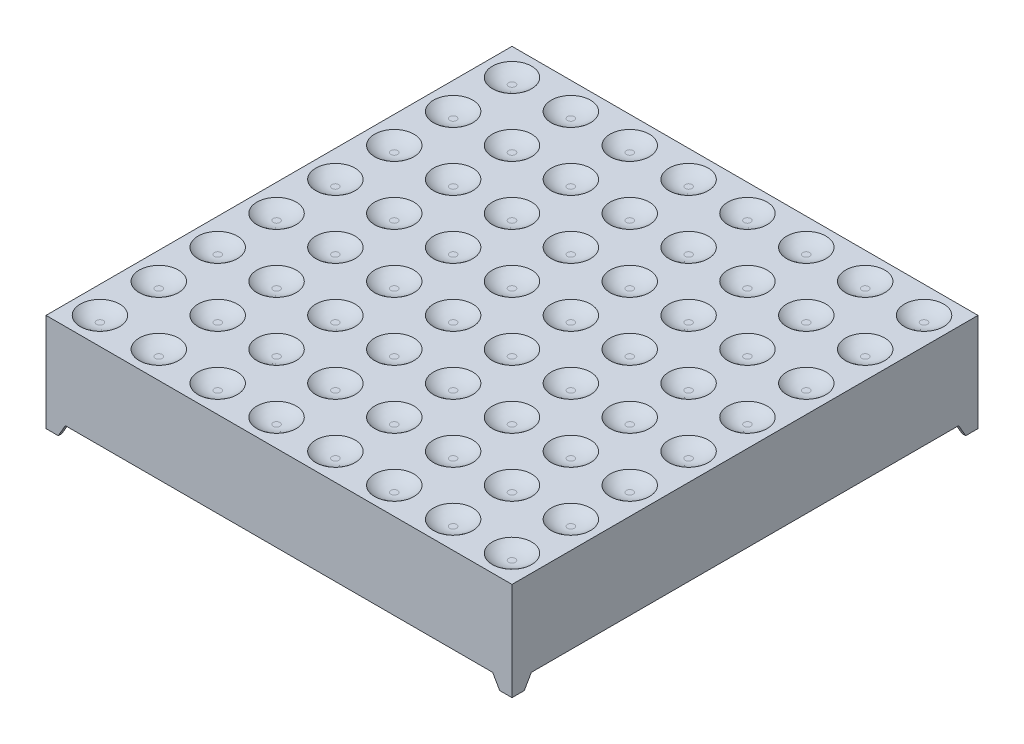
from build123d import *

# Parameters (mm, degrees)
SKETCH1_W           = 38
SKETCH1_H           = 38
BOSS_EXTRUDE1_DEPTH = 4
SKETCH2_W           = 37.4
SKETCH2_H           = 37.4
CUT_EXTRUDE1_DEPTH  = 1.5
CUT_EXTRUDE2_DEPTH  = 43.673176587
CUT_EXTRUDE3_DEPTH  = 43.673176587
SKETCH5_R           = 1.6
CUT_EXTRUDE4_DEPTH  = 0.5
FILLET1_R           = 2
SKETCH6_R           = 0.255
BOSS_EXTRUDE2_DEPTH = 6


with BuildPart() as part:
    # Sketch1 → Boss-Extrude1 (new, symmetric)
    with BuildSketch(Plane(origin=(0, 0, 0), x_dir=(1, 0, 0), z_dir=(0, 1, 0))):
        Rectangle(SKETCH1_W, SKETCH1_H)
    extrude(amount=BOSS_EXTRUDE1_DEPTH, both=True)

    # Sketch2 → Cut-Extrude1 (cut)
    with BuildSketch(Plane.XZ.offset(4)):
        Rectangle(SKETCH2_W, SKETCH2_H)
    extrude(amount=-CUT_EXTRUDE1_DEPTH, mode=Mode.SUBTRACT)

    # Sketch3 → Cut-Extrude2 (cut, through all)
    with BuildSketch(Plane.XY.offset(19)):
        Polygon((-18, -4), (-17.422649731, -3), (17.422649731, -3), (18, -4), align=None)
    extrude(amount=-CUT_EXTRUDE2_DEPTH, mode=Mode.SUBTRACT)

    # Sketch4 → Cut-Extrude3 (cut, through all)
    with BuildSketch(Plane.ZY.offset(19)):
        Polygon((-18, -4), (-17.422649731, -3), (17.422649731, -3), (18, -4), align=None)
    extrude(amount=-CUT_EXTRUDE3_DEPTH, mode=Mode.SUBTRACT)

    # Sketch5 → Cut-Extrude4 (cut)
    with BuildSketch(Plane(origin=(0, 4, 0), x_dir=(1, 0, 0), z_dir=(0, 1, 0))):
        with Locations(Location((-16.8, 16.8, 0), (0, 0, 270))):
            Circle(SKETCH5_R)
        with Locations(Location((-12, 16.8, 0), (0, 0, 270))):
            Circle(SKETCH5_R)
        with Locations(Location((-7.2, 16.8, 0), (0, 0, 270))):
            Circle(SKETCH5_R)
        with Locations(Location((-2.4, 16.8, 0), (0, 0, 270))):
            Circle(SKETCH5_R)
        with Locations(Location((2.4, 16.8, 0), (0, 0, 270))):
            Circle(SKETCH5_R)
        with Locations(Location((7.2, 16.8, 0), (0, 0, 270))):
            Circle(SKETCH5_R)
        with Locations(Location((12, 16.8, 0), (0, 0, 270))):
            Circle(SKETCH5_R)
        with Locations(Location((16.8, 16.8, 0), (0, 0, 270))):
            Circle(SKETCH5_R)
        with Locations(Location((-16.8, 12, 0), (0, 0, 270))):
            Circle(SKETCH5_R)
        with Locations(Location((-12, 12, 0), (0, 0, 270))):
            Circle(SKETCH5_R)
        with Locations(Location((-7.2, 12, 0), (0, 0, 270))):
            Circle(SKETCH5_R)
        with Locations(Location((-2.4, 12, 0), (0, 0, 270))):
            Circle(SKETCH5_R)
        with Locations(Location((2.4, 12, 0), (0, 0, 270))):
            Circle(SKETCH5_R)
        with Locations(Location((7.2, 12, 0), (0, 0, 270))):
            Circle(SKETCH5_R)
        with Locations(Location((12, 12, 0), (0, 0, 270))):
            Circle(SKETCH5_R)
        with Locations(Location((16.8, 12, 0), (0, 0, 270))):
            Circle(SKETCH5_R)
        with Locations(Location((-16.8, 7.2, 0), (0, 0, 270))):
            Circle(SKETCH5_R)
        with Locations(Location((-12, 7.2, 0), (0, 0, 270))):
            Circle(SKETCH5_R)
        with Locations(Location((-7.2, 7.2, 0), (0, 0, 270))):
            Circle(SKETCH5_R)
        with Locations(Location((-2.4, 7.2, 0), (0, 0, 270))):
            Circle(SKETCH5_R)
        with Locations(Location((2.4, 7.2, 0), (0, 0, 270))):
            Circle(SKETCH5_R)
        with Locations(Location((7.2, 7.2, 0), (0, 0, 270))):
            Circle(SKETCH5_R)
        with Locations(Location((12, 7.2, 0), (0, 0, 270))):
            Circle(SKETCH5_R)
        with Locations(Location((16.8, 7.2, 0), (0, 0, 270))):
            Circle(SKETCH5_R)
        with Locations(Location((-16.8, 2.4, 0), (0, 0, 270))):
            Circle(SKETCH5_R)
        with Locations(Location((-12, 2.4, 0), (0, 0, 270))):
            Circle(SKETCH5_R)
        with Locations(Location((-7.2, 2.4, 0), (0, 0, 270))):
            Circle(SKETCH5_R)
        with Locations(Location((-2.4, 2.4, 0), (0, 0, 270))):
            Circle(SKETCH5_R)
        with Locations(Location((2.4, 2.4, 0), (0, 0, 270))):
            Circle(SKETCH5_R)
        with Locations(Location((7.2, 2.4, 0), (0, 0, 270))):
            Circle(SKETCH5_R)
        with Locations(Location((12, 2.4, 0), (0, 0, 270))):
            Circle(SKETCH5_R)
        with Locations(Location((16.8, 2.4, 0), (0, 0, 270))):
            Circle(SKETCH5_R)
        with Locations(Location((-16.8, -2.4, 0), (0, 0, 270))):
            Circle(SKETCH5_R)
        with Locations(Location((-12, -2.4, 0), (0, 0, 270))):
            Circle(SKETCH5_R)
        with Locations(Location((-7.2, -2.4, 0), (0, 0, 270))):
            Circle(SKETCH5_R)
        with Locations(Location((-2.4, -2.4, 0), (0, 0, 270))):
            Circle(SKETCH5_R)
        with Locations(Location((2.4, -2.4, 0), (0, 0, 270))):
            Circle(SKETCH5_R)
        with Locations(Location((7.2, -2.4, 0), (0, 0, 270))):
            Circle(SKETCH5_R)
        with Locations(Location((12, -2.4, 0), (0, 0, 270))):
            Circle(SKETCH5_R)
        with Locations(Location((16.8, -2.4, 0), (0, 0, 270))):
            Circle(SKETCH5_R)
        with Locations(Location((-16.8, -7.2, 0), (0, 0, 270))):
            Circle(SKETCH5_R)
        with Locations(Location((-12, -7.2, 0), (0, 0, 270))):
            Circle(SKETCH5_R)
        with Locations(Location((-7.2, -7.2, 0), (0, 0, 270))):
            Circle(SKETCH5_R)
        with Locations(Location((-2.4, -7.2, 0), (0, 0, 270))):
            Circle(SKETCH5_R)
        with Locations(Location((2.4, -7.2, 0), (0, 0, 270))):
            Circle(SKETCH5_R)
        with Locations(Location((7.2, -7.2, 0), (0, 0, 270))):
            Circle(SKETCH5_R)
        with Locations(Location((12, -7.2, 0), (0, 0, 270))):
            Circle(SKETCH5_R)
        with Locations(Location((16.8, -7.2, 0), (0, 0, 270))):
            Circle(SKETCH5_R)
        with Locations(Location((-16.8, -12, 0), (0, 0, 270))):
            Circle(SKETCH5_R)
        with Locations(Location((-12, -12, 0), (0, 0, 270))):
            Circle(SKETCH5_R)
        with Locations(Location((-7.2, -12, 0), (0, 0, 270))):
            Circle(SKETCH5_R)
        with Locations(Location((-2.4, -12, 0), (0, 0, 270))):
            Circle(SKETCH5_R)
        with Locations(Location((2.4, -12, 0), (0, 0, 270))):
            Circle(SKETCH5_R)
        with Locations(Location((7.2, -12, 0), (0, 0, 270))):
            Circle(SKETCH5_R)
        with Locations(Location((12, -12, 0), (0, 0, 270))):
            Circle(SKETCH5_R)
        with Locations(Location((16.8, -12, 0), (0, 0, 270))):
            Circle(SKETCH5_R)
        with Locations(Location((-16.8, -16.8, 0), (0, 0, 270))):
            Circle(SKETCH5_R)
        with Locations(Location((-12, -16.8, 0), (0, 0, 270))):
            Circle(SKETCH5_R)
        with Locations(Location((-7.2, -16.8, 0), (0, 0, 270))):
            Circle(SKETCH5_R)
        with Locations(Location((-2.4, -16.8, 0), (0, 0, 270))):
            Circle(SKETCH5_R)
        with Locations(Location((2.4, -16.8, 0), (0, 0, 270))):
            Circle(SKETCH5_R)
        with Locations(Location((7.2, -16.8, 0), (0, 0, 270))):
            Circle(SKETCH5_R)
        with Locations(Location((12, -16.8, 0), (0, 0, 270))):
            Circle(SKETCH5_R)
        with Locations(Location((16.8, -16.8, 0), (0, 0, 270))):
            Circle(SKETCH5_R)
    extrude(amount=-CUT_EXTRUDE4_DEPTH, mode=Mode.SUBTRACT)

    # Fillet1
    # the kernel refuses this fillet: 2 mm, written as the material it adds along each edge
    with BuildSketch(Plane(origin=(7.2, 3.5, -16.8), x_dir=(0, 0, 1), z_dir=(-1, 0, 0))) as fillet1_piece_1:
        with BuildLine():
            CenterArc((0.277124344, 2), FILLET1_R, 270, 41.409622109)
            Line((0.277124344, 0), (0.277124344, -0.04))
            Line((0.277124344, -0.04), (1.6, -0.04))
            Line((1.6, -0.04), (1.64, 0))
            ThreePointArc((1.64, 0), (1.64, 0.25), (1.626457513, 0.47))
            Line((1.626457513, 0.47), (1.6, 0.5))
        make_face()
    revolve(axis=Axis((7.2, 3.5, -16.8), (0, 1, 0)))
    with BuildSketch(Plane(origin=(12, 3.5, -16.8), x_dir=(0, 0, 1), z_dir=(-1, 0, 0))) as fillet1_piece_2:
        with BuildLine():
            CenterArc((0.277124344, 2), FILLET1_R, 270, 41.409622109)
            Line((0.277124344, 0), (0.277124344, -0.04))
            Line((0.277124344, -0.04), (1.6, -0.04))
            Line((1.6, -0.04), (1.64, 0))
            ThreePointArc((1.64, 0), (1.64, 0.25), (1.626457513, 0.47))
            Line((1.626457513, 0.47), (1.6, 0.5))
        make_face()
    revolve(axis=Axis((12, 3.5, -16.8), (0, 1, 0)))
    with BuildSketch(Plane(origin=(16.8, 3.5, -16.8), x_dir=(0, 0, 1), z_dir=(-1, 0, 0))) as fillet1_piece_3:
        with BuildLine():
            CenterArc((0.277124344, 2), FILLET1_R, 270, 41.409622109)
            Line((0.277124344, 0), (0.277124344, -0.04))
            Line((0.277124344, -0.04), (1.6, -0.04))
            Line((1.6, -0.04), (1.64, 0))
            ThreePointArc((1.64, 0), (1.64, 0.25), (1.626457513, 0.47))
            Line((1.626457513, 0.47), (1.6, 0.5))
        make_face()
    revolve(axis=Axis((16.8, 3.5, -16.8), (0, 1, 0)))
    with BuildSketch(Plane(origin=(-16.8, 3.5, -12), x_dir=(0, 0, 1), z_dir=(-1, 0, 0))) as fillet1_piece_4:
        with BuildLine():
            CenterArc((0.277124344, 2), FILLET1_R, 270, 41.409622109)
            Line((0.277124344, 0), (0.277124344, -0.04))
            Line((0.277124344, -0.04), (1.6, -0.04))
            Line((1.6, -0.04), (1.64, 0))
            ThreePointArc((1.64, 0), (1.64, 0.25), (1.626457513, 0.47))
            Line((1.626457513, 0.47), (1.6, 0.5))
        make_face()
    revolve(axis=Axis((-16.8, 3.5, -12), (0, 1, 0)))
    with BuildSketch(Plane(origin=(-12, 3.5, -12), x_dir=(0, 0, 1), z_dir=(-1, 0, 0))) as fillet1_piece_5:
        with BuildLine():
            CenterArc((0.277124344, 2), FILLET1_R, 270, 41.409622109)
            Line((0.277124344, 0), (0.277124344, -0.04))
            Line((0.277124344, -0.04), (1.6, -0.04))
            Line((1.6, -0.04), (1.64, 0))
            ThreePointArc((1.64, 0), (1.64, 0.25), (1.626457513, 0.47))
            Line((1.626457513, 0.47), (1.6, 0.5))
        make_face()
    revolve(axis=Axis((-12, 3.5, -12), (0, 1, 0)))
    with BuildSketch(Plane(origin=(-7.2, 3.5, -12), x_dir=(0, 0, 1), z_dir=(-1, 0, 0))) as fillet1_piece_6:
        with BuildLine():
            CenterArc((0.277124344, 2), FILLET1_R, 270, 41.409622109)
            Line((0.277124344, 0), (0.277124344, -0.04))
            Line((0.277124344, -0.04), (1.6, -0.04))
            Line((1.6, -0.04), (1.64, 0))
            ThreePointArc((1.64, 0), (1.64, 0.25), (1.626457513, 0.47))
            Line((1.626457513, 0.47), (1.6, 0.5))
        make_face()
    revolve(axis=Axis((-7.2, 3.5, -12), (0, 1, 0)))
    with BuildSketch(Plane(origin=(-2.4, 3.5, -12), x_dir=(0, 0, 1), z_dir=(-1, 0, 0))) as fillet1_piece_7:
        with BuildLine():
            CenterArc((0.277124344, 2), FILLET1_R, 270, 41.409622109)
            Line((0.277124344, 0), (0.277124344, -0.04))
            Line((0.277124344, -0.04), (1.6, -0.04))
            Line((1.6, -0.04), (1.64, 0))
            ThreePointArc((1.64, 0), (1.64, 0.25), (1.626457513, 0.47))
            Line((1.626457513, 0.47), (1.6, 0.5))
        make_face()
    revolve(axis=Axis((-2.4, 3.5, -12), (0, 1, 0)))
    with BuildSketch(Plane(origin=(2.4, 3.5, -12), x_dir=(0, 0, 1), z_dir=(-1, 0, 0))) as fillet1_piece_8:
        with BuildLine():
            CenterArc((0.277124344, 2), FILLET1_R, 270, 41.409622109)
            Line((0.277124344, 0), (0.277124344, -0.04))
            Line((0.277124344, -0.04), (1.6, -0.04))
            Line((1.6, -0.04), (1.64, 0))
            ThreePointArc((1.64, 0), (1.64, 0.25), (1.626457513, 0.47))
            Line((1.626457513, 0.47), (1.6, 0.5))
        make_face()
    revolve(axis=Axis((2.4, 3.5, -12), (0, 1, 0)))
    with BuildSketch(Plane(origin=(7.2, 3.5, -12), x_dir=(0, 0, 1), z_dir=(-1, 0, 0))) as fillet1_piece_9:
        with BuildLine():
            CenterArc((0.277124344, 2), FILLET1_R, 270, 41.409622109)
            Line((0.277124344, 0), (0.277124344, -0.04))
            Line((0.277124344, -0.04), (1.6, -0.04))
            Line((1.6, -0.04), (1.64, 0))
            ThreePointArc((1.64, 0), (1.64, 0.25), (1.626457513, 0.47))
            Line((1.626457513, 0.47), (1.6, 0.5))
        make_face()
    revolve(axis=Axis((7.2, 3.5, -12), (0, 1, 0)))
    with BuildSketch(Plane(origin=(12, 3.5, -12), x_dir=(0, 0, 1), z_dir=(-1, 0, 0))) as fillet1_piece_10:
        with BuildLine():
            CenterArc((0.277124344, 2), FILLET1_R, 270, 41.409622109)
            Line((0.277124344, 0), (0.277124344, -0.04))
            Line((0.277124344, -0.04), (1.6, -0.04))
            Line((1.6, -0.04), (1.64, 0))
            ThreePointArc((1.64, 0), (1.64, 0.25), (1.626457513, 0.47))
            Line((1.626457513, 0.47), (1.6, 0.5))
        make_face()
    revolve(axis=Axis((12, 3.5, -12), (0, 1, 0)))
    with BuildSketch(Plane(origin=(16.8, 3.5, -12), x_dir=(0, 0, 1), z_dir=(-1, 0, 0))) as fillet1_piece_11:
        with BuildLine():
            CenterArc((0.277124344, 2), FILLET1_R, 270, 41.409622109)
            Line((0.277124344, 0), (0.277124344, -0.04))
            Line((0.277124344, -0.04), (1.6, -0.04))
            Line((1.6, -0.04), (1.64, 0))
            ThreePointArc((1.64, 0), (1.64, 0.25), (1.626457513, 0.47))
            Line((1.626457513, 0.47), (1.6, 0.5))
        make_face()
    revolve(axis=Axis((16.8, 3.5, -12), (0, 1, 0)))
    with BuildSketch(Plane(origin=(-16.8, 3.5, -7.2), x_dir=(0, 0, 1), z_dir=(-1, 0, 0))) as fillet1_piece_12:
        with BuildLine():
            CenterArc((0.277124344, 2), FILLET1_R, 270, 41.409622109)
            Line((0.277124344, 0), (0.277124344, -0.04))
            Line((0.277124344, -0.04), (1.6, -0.04))
            Line((1.6, -0.04), (1.64, 0))
            ThreePointArc((1.64, 0), (1.64, 0.25), (1.626457513, 0.47))
            Line((1.626457513, 0.47), (1.6, 0.5))
        make_face()
    revolve(axis=Axis((-16.8, 3.5, -7.2), (0, 1, 0)))
    with BuildSketch(Plane(origin=(-12, 3.5, -7.2), x_dir=(0, 0, 1), z_dir=(-1, 0, 0))) as fillet1_piece_13:
        with BuildLine():
            CenterArc((0.277124344, 2), FILLET1_R, 270, 41.409622109)
            Line((0.277124344, 0), (0.277124344, -0.04))
            Line((0.277124344, -0.04), (1.6, -0.04))
            Line((1.6, -0.04), (1.64, 0))
            ThreePointArc((1.64, 0), (1.64, 0.25), (1.626457513, 0.47))
            Line((1.626457513, 0.47), (1.6, 0.5))
        make_face()
    revolve(axis=Axis((-12, 3.5, -7.2), (0, 1, 0)))
    with BuildSketch(Plane(origin=(-7.2, 3.5, -7.2), x_dir=(0, 0, 1), z_dir=(-1, 0, 0))) as fillet1_piece_14:
        with BuildLine():
            CenterArc((0.277124344, 2), FILLET1_R, 270, 41.409622109)
            Line((0.277124344, 0), (0.277124344, -0.04))
            Line((0.277124344, -0.04), (1.6, -0.04))
            Line((1.6, -0.04), (1.64, 0))
            ThreePointArc((1.64, 0), (1.64, 0.25), (1.626457513, 0.47))
            Line((1.626457513, 0.47), (1.6, 0.5))
        make_face()
    revolve(axis=Axis((-7.2, 3.5, -7.2), (0, 1, 0)))
    with BuildSketch(Plane(origin=(-2.4, 3.5, -7.2), x_dir=(0, 0, 1), z_dir=(-1, 0, 0))) as fillet1_piece_15:
        with BuildLine():
            CenterArc((0.277124344, 2), FILLET1_R, 270, 41.409622109)
            Line((0.277124344, 0), (0.277124344, -0.04))
            Line((0.277124344, -0.04), (1.6, -0.04))
            Line((1.6, -0.04), (1.64, 0))
            ThreePointArc((1.64, 0), (1.64, 0.25), (1.626457513, 0.47))
            Line((1.626457513, 0.47), (1.6, 0.5))
        make_face()
    revolve(axis=Axis((-2.4, 3.5, -7.2), (0, 1, 0)))
    with BuildSketch(Plane(origin=(2.4, 3.5, -7.2), x_dir=(0, 0, 1), z_dir=(-1, 0, 0))) as fillet1_piece_16:
        with BuildLine():
            CenterArc((0.277124344, 2), FILLET1_R, 270, 41.409622109)
            Line((0.277124344, 0), (0.277124344, -0.04))
            Line((0.277124344, -0.04), (1.6, -0.04))
            Line((1.6, -0.04), (1.64, 0))
            ThreePointArc((1.64, 0), (1.64, 0.25), (1.626457513, 0.47))
            Line((1.626457513, 0.47), (1.6, 0.5))
        make_face()
    revolve(axis=Axis((2.4, 3.5, -7.2), (0, 1, 0)))
    with BuildSketch(Plane(origin=(7.2, 3.5, -7.2), x_dir=(0, 0, 1), z_dir=(-1, 0, 0))) as fillet1_piece_17:
        with BuildLine():
            CenterArc((0.277124344, 2), FILLET1_R, 270, 41.409622109)
            Line((0.277124344, 0), (0.277124344, -0.04))
            Line((0.277124344, -0.04), (1.6, -0.04))
            Line((1.6, -0.04), (1.64, 0))
            ThreePointArc((1.64, 0), (1.64, 0.25), (1.626457513, 0.47))
            Line((1.626457513, 0.47), (1.6, 0.5))
        make_face()
    revolve(axis=Axis((7.2, 3.5, -7.2), (0, 1, 0)))
    with BuildSketch(Plane(origin=(12, 3.5, -7.2), x_dir=(0, 0, 1), z_dir=(-1, 0, 0))) as fillet1_piece_18:
        with BuildLine():
            CenterArc((0.277124344, 2), FILLET1_R, 270, 41.409622109)
            Line((0.277124344, 0), (0.277124344, -0.04))
            Line((0.277124344, -0.04), (1.6, -0.04))
            Line((1.6, -0.04), (1.64, 0))
            ThreePointArc((1.64, 0), (1.64, 0.25), (1.626457513, 0.47))
            Line((1.626457513, 0.47), (1.6, 0.5))
        make_face()
    revolve(axis=Axis((12, 3.5, -7.2), (0, 1, 0)))
    with BuildSketch(Plane(origin=(16.8, 3.5, -7.2), x_dir=(0, 0, 1), z_dir=(-1, 0, 0))) as fillet1_piece_19:
        with BuildLine():
            CenterArc((0.277124344, 2), FILLET1_R, 270, 41.409622109)
            Line((0.277124344, 0), (0.277124344, -0.04))
            Line((0.277124344, -0.04), (1.6, -0.04))
            Line((1.6, -0.04), (1.64, 0))
            ThreePointArc((1.64, 0), (1.64, 0.25), (1.626457513, 0.47))
            Line((1.626457513, 0.47), (1.6, 0.5))
        make_face()
    revolve(axis=Axis((16.8, 3.5, -7.2), (0, 1, 0)))
    with BuildSketch(Plane(origin=(-16.8, 3.5, -2.4), x_dir=(0, 0, 1), z_dir=(-1, 0, 0))) as fillet1_piece_20:
        with BuildLine():
            CenterArc((0.277124344, 2), FILLET1_R, 270, 41.409622109)
            Line((0.277124344, 0), (0.277124344, -0.04))
            Line((0.277124344, -0.04), (1.6, -0.04))
            Line((1.6, -0.04), (1.64, 0))
            ThreePointArc((1.64, 0), (1.64, 0.25), (1.626457513, 0.47))
            Line((1.626457513, 0.47), (1.6, 0.5))
        make_face()
    revolve(axis=Axis((-16.8, 3.5, -2.4), (0, 1, 0)))
    with BuildSketch(Plane(origin=(-12, 3.5, -2.4), x_dir=(0, 0, 1), z_dir=(-1, 0, 0))) as fillet1_piece_21:
        with BuildLine():
            CenterArc((0.277124344, 2), FILLET1_R, 270, 41.409622109)
            Line((0.277124344, 0), (0.277124344, -0.04))
            Line((0.277124344, -0.04), (1.6, -0.04))
            Line((1.6, -0.04), (1.64, 0))
            ThreePointArc((1.64, 0), (1.64, 0.25), (1.626457513, 0.47))
            Line((1.626457513, 0.47), (1.6, 0.5))
        make_face()
    revolve(axis=Axis((-12, 3.5, -2.4), (0, 1, 0)))
    with BuildSketch(Plane(origin=(-7.2, 3.5, -2.4), x_dir=(0, 0, 1), z_dir=(-1, 0, 0))) as fillet1_piece_22:
        with BuildLine():
            CenterArc((0.277124344, 2), FILLET1_R, 270, 41.409622109)
            Line((0.277124344, 0), (0.277124344, -0.04))
            Line((0.277124344, -0.04), (1.6, -0.04))
            Line((1.6, -0.04), (1.64, 0))
            ThreePointArc((1.64, 0), (1.64, 0.25), (1.626457513, 0.47))
            Line((1.626457513, 0.47), (1.6, 0.5))
        make_face()
    revolve(axis=Axis((-7.2, 3.5, -2.4), (0, 1, 0)))
    with BuildSketch(Plane(origin=(-2.4, 3.5, -2.4), x_dir=(0, 0, 1), z_dir=(-1, 0, 0))) as fillet1_piece_23:
        with BuildLine():
            CenterArc((0.277124344, 2), FILLET1_R, 270, 41.409622109)
            Line((0.277124344, 0), (0.277124344, -0.04))
            Line((0.277124344, -0.04), (1.6, -0.04))
            Line((1.6, -0.04), (1.64, 0))
            ThreePointArc((1.64, 0), (1.64, 0.25), (1.626457513, 0.47))
            Line((1.626457513, 0.47), (1.6, 0.5))
        make_face()
    revolve(axis=Axis((-2.4, 3.5, -2.4), (0, 1, 0)))
    with BuildSketch(Plane(origin=(2.4, 3.5, -2.4), x_dir=(0, 0, 1), z_dir=(-1, 0, 0))) as fillet1_piece_24:
        with BuildLine():
            CenterArc((0.277124344, 2), FILLET1_R, 270, 41.409622109)
            Line((0.277124344, 0), (0.277124344, -0.04))
            Line((0.277124344, -0.04), (1.6, -0.04))
            Line((1.6, -0.04), (1.64, 0))
            ThreePointArc((1.64, 0), (1.64, 0.25), (1.626457513, 0.47))
            Line((1.626457513, 0.47), (1.6, 0.5))
        make_face()
    revolve(axis=Axis((2.4, 3.5, -2.4), (0, 1, 0)))
    with BuildSketch(Plane(origin=(7.2, 3.5, -2.4), x_dir=(0, 0, 1), z_dir=(-1, 0, 0))) as fillet1_piece_25:
        with BuildLine():
            CenterArc((0.277124344, 2), FILLET1_R, 270, 41.409622109)
            Line((0.277124344, 0), (0.277124344, -0.04))
            Line((0.277124344, -0.04), (1.6, -0.04))
            Line((1.6, -0.04), (1.64, 0))
            ThreePointArc((1.64, 0), (1.64, 0.25), (1.626457513, 0.47))
            Line((1.626457513, 0.47), (1.6, 0.5))
        make_face()
    revolve(axis=Axis((7.2, 3.5, -2.4), (0, 1, 0)))
    with BuildSketch(Plane(origin=(12, 3.5, -2.4), x_dir=(0, 0, 1), z_dir=(-1, 0, 0))) as fillet1_piece_26:
        with BuildLine():
            CenterArc((0.277124344, 2), FILLET1_R, 270, 41.409622109)
            Line((0.277124344, 0), (0.277124344, -0.04))
            Line((0.277124344, -0.04), (1.6, -0.04))
            Line((1.6, -0.04), (1.64, 0))
            ThreePointArc((1.64, 0), (1.64, 0.25), (1.626457513, 0.47))
            Line((1.626457513, 0.47), (1.6, 0.5))
        make_face()
    revolve(axis=Axis((12, 3.5, -2.4), (0, 1, 0)))
    with BuildSketch(Plane(origin=(16.8, 3.5, -2.4), x_dir=(0, 0, 1), z_dir=(-1, 0, 0))) as fillet1_piece_27:
        with BuildLine():
            CenterArc((0.277124344, 2), FILLET1_R, 270, 41.409622109)
            Line((0.277124344, 0), (0.277124344, -0.04))
            Line((0.277124344, -0.04), (1.6, -0.04))
            Line((1.6, -0.04), (1.64, 0))
            ThreePointArc((1.64, 0), (1.64, 0.25), (1.626457513, 0.47))
            Line((1.626457513, 0.47), (1.6, 0.5))
        make_face()
    revolve(axis=Axis((16.8, 3.5, -2.4), (0, 1, 0)))
    with BuildSketch(Plane(origin=(-16.8, 3.5, 2.4), x_dir=(0, 0, 1), z_dir=(-1, 0, 0))) as fillet1_piece_28:
        with BuildLine():
            CenterArc((0.277124344, 2), FILLET1_R, 270, 41.409622109)
            Line((0.277124344, 0), (0.277124344, -0.04))
            Line((0.277124344, -0.04), (1.6, -0.04))
            Line((1.6, -0.04), (1.64, 0))
            ThreePointArc((1.64, 0), (1.64, 0.25), (1.626457513, 0.47))
            Line((1.626457513, 0.47), (1.6, 0.5))
        make_face()
    revolve(axis=Axis((-16.8, 3.5, 2.4), (0, 1, 0)))
    with BuildSketch(Plane(origin=(-12, 3.5, 2.4), x_dir=(0, 0, 1), z_dir=(-1, 0, 0))) as fillet1_piece_29:
        with BuildLine():
            CenterArc((0.277124344, 2), FILLET1_R, 270, 41.409622109)
            Line((0.277124344, 0), (0.277124344, -0.04))
            Line((0.277124344, -0.04), (1.6, -0.04))
            Line((1.6, -0.04), (1.64, 0))
            ThreePointArc((1.64, 0), (1.64, 0.25), (1.626457513, 0.47))
            Line((1.626457513, 0.47), (1.6, 0.5))
        make_face()
    revolve(axis=Axis((-12, 3.5, 2.4), (0, 1, 0)))
    with BuildSketch(Plane(origin=(-7.2, 3.5, 2.4), x_dir=(0, 0, 1), z_dir=(-1, 0, 0))) as fillet1_piece_30:
        with BuildLine():
            CenterArc((0.277124344, 2), FILLET1_R, 270, 41.409622109)
            Line((0.277124344, 0), (0.277124344, -0.04))
            Line((0.277124344, -0.04), (1.6, -0.04))
            Line((1.6, -0.04), (1.64, 0))
            ThreePointArc((1.64, 0), (1.64, 0.25), (1.626457513, 0.47))
            Line((1.626457513, 0.47), (1.6, 0.5))
        make_face()
    revolve(axis=Axis((-7.2, 3.5, 2.4), (0, 1, 0)))
    with BuildSketch(Plane(origin=(-2.4, 3.5, 2.4), x_dir=(0, 0, 1), z_dir=(-1, 0, 0))) as fillet1_piece_31:
        with BuildLine():
            CenterArc((0.277124344, 2), FILLET1_R, 270, 41.409622109)
            Line((0.277124344, 0), (0.277124344, -0.04))
            Line((0.277124344, -0.04), (1.6, -0.04))
            Line((1.6, -0.04), (1.64, 0))
            ThreePointArc((1.64, 0), (1.64, 0.25), (1.626457513, 0.47))
            Line((1.626457513, 0.47), (1.6, 0.5))
        make_face()
    revolve(axis=Axis((-2.4, 3.5, 2.4), (0, 1, 0)))
    with BuildSketch(Plane(origin=(2.4, 3.5, 2.4), x_dir=(0, 0, 1), z_dir=(-1, 0, 0))) as fillet1_piece_32:
        with BuildLine():
            CenterArc((0.277124344, 2), FILLET1_R, 270, 41.409622109)
            Line((0.277124344, 0), (0.277124344, -0.04))
            Line((0.277124344, -0.04), (1.6, -0.04))
            Line((1.6, -0.04), (1.64, 0))
            ThreePointArc((1.64, 0), (1.64, 0.25), (1.626457513, 0.47))
            Line((1.626457513, 0.47), (1.6, 0.5))
        make_face()
    revolve(axis=Axis((2.4, 3.5, 2.4), (0, 1, 0)))
    with BuildSketch(Plane(origin=(7.2, 3.5, 2.4), x_dir=(0, 0, 1), z_dir=(-1, 0, 0))) as fillet1_piece_33:
        with BuildLine():
            CenterArc((0.277124344, 2), FILLET1_R, 270, 41.409622109)
            Line((0.277124344, 0), (0.277124344, -0.04))
            Line((0.277124344, -0.04), (1.6, -0.04))
            Line((1.6, -0.04), (1.64, 0))
            ThreePointArc((1.64, 0), (1.64, 0.25), (1.626457513, 0.47))
            Line((1.626457513, 0.47), (1.6, 0.5))
        make_face()
    revolve(axis=Axis((7.2, 3.5, 2.4), (0, 1, 0)))
    with BuildSketch(Plane(origin=(12, 3.5, 2.4), x_dir=(0, 0, 1), z_dir=(-1, 0, 0))) as fillet1_piece_34:
        with BuildLine():
            CenterArc((0.277124344, 2), FILLET1_R, 270, 41.409622109)
            Line((0.277124344, 0), (0.277124344, -0.04))
            Line((0.277124344, -0.04), (1.6, -0.04))
            Line((1.6, -0.04), (1.64, 0))
            ThreePointArc((1.64, 0), (1.64, 0.25), (1.626457513, 0.47))
            Line((1.626457513, 0.47), (1.6, 0.5))
        make_face()
    revolve(axis=Axis((12, 3.5, 2.4), (0, 1, 0)))
    with BuildSketch(Plane(origin=(16.8, 3.5, 2.4), x_dir=(0, 0, 1), z_dir=(-1, 0, 0))) as fillet1_piece_35:
        with BuildLine():
            CenterArc((0.277124344, 2), FILLET1_R, 270, 41.409622109)
            Line((0.277124344, 0), (0.277124344, -0.04))
            Line((0.277124344, -0.04), (1.6, -0.04))
            Line((1.6, -0.04), (1.64, 0))
            ThreePointArc((1.64, 0), (1.64, 0.25), (1.626457513, 0.47))
            Line((1.626457513, 0.47), (1.6, 0.5))
        make_face()
    revolve(axis=Axis((16.8, 3.5, 2.4), (0, 1, 0)))
    with BuildSketch(Plane(origin=(-16.8, 3.5, 7.2), x_dir=(0, 0, 1), z_dir=(-1, 0, 0))) as fillet1_piece_36:
        with BuildLine():
            CenterArc((0.277124344, 2), FILLET1_R, 270, 41.409622109)
            Line((0.277124344, 0), (0.277124344, -0.04))
            Line((0.277124344, -0.04), (1.6, -0.04))
            Line((1.6, -0.04), (1.64, 0))
            ThreePointArc((1.64, 0), (1.64, 0.25), (1.626457513, 0.47))
            Line((1.626457513, 0.47), (1.6, 0.5))
        make_face()
    revolve(axis=Axis((-16.8, 3.5, 7.2), (0, 1, 0)))
    with BuildSketch(Plane(origin=(-12, 3.5, 7.2), x_dir=(0, 0, 1), z_dir=(-1, 0, 0))) as fillet1_piece_37:
        with BuildLine():
            CenterArc((0.277124344, 2), FILLET1_R, 270, 41.409622109)
            Line((0.277124344, 0), (0.277124344, -0.04))
            Line((0.277124344, -0.04), (1.6, -0.04))
            Line((1.6, -0.04), (1.64, 0))
            ThreePointArc((1.64, 0), (1.64, 0.25), (1.626457513, 0.47))
            Line((1.626457513, 0.47), (1.6, 0.5))
        make_face()
    revolve(axis=Axis((-12, 3.5, 7.2), (0, 1, 0)))
    with BuildSketch(Plane(origin=(-7.2, 3.5, 7.2), x_dir=(0, 0, 1), z_dir=(-1, 0, 0))) as fillet1_piece_38:
        with BuildLine():
            CenterArc((0.277124344, 2), FILLET1_R, 270, 41.409622109)
            Line((0.277124344, 0), (0.277124344, -0.04))
            Line((0.277124344, -0.04), (1.6, -0.04))
            Line((1.6, -0.04), (1.64, 0))
            ThreePointArc((1.64, 0), (1.64, 0.25), (1.626457513, 0.47))
            Line((1.626457513, 0.47), (1.6, 0.5))
        make_face()
    revolve(axis=Axis((-7.2, 3.5, 7.2), (0, 1, 0)))
    with BuildSketch(Plane(origin=(-2.4, 3.5, 7.2), x_dir=(0, 0, 1), z_dir=(-1, 0, 0))) as fillet1_piece_39:
        with BuildLine():
            CenterArc((0.277124344, 2), FILLET1_R, 270, 41.409622109)
            Line((0.277124344, 0), (0.277124344, -0.04))
            Line((0.277124344, -0.04), (1.6, -0.04))
            Line((1.6, -0.04), (1.64, 0))
            ThreePointArc((1.64, 0), (1.64, 0.25), (1.626457513, 0.47))
            Line((1.626457513, 0.47), (1.6, 0.5))
        make_face()
    revolve(axis=Axis((-2.4, 3.5, 7.2), (0, 1, 0)))
    with BuildSketch(Plane(origin=(2.4, 3.5, 7.2), x_dir=(0, 0, 1), z_dir=(-1, 0, 0))) as fillet1_piece_40:
        with BuildLine():
            CenterArc((0.277124344, 2), FILLET1_R, 270, 41.409622109)
            Line((0.277124344, 0), (0.277124344, -0.04))
            Line((0.277124344, -0.04), (1.6, -0.04))
            Line((1.6, -0.04), (1.64, 0))
            ThreePointArc((1.64, 0), (1.64, 0.25), (1.626457513, 0.47))
            Line((1.626457513, 0.47), (1.6, 0.5))
        make_face()
    revolve(axis=Axis((2.4, 3.5, 7.2), (0, 1, 0)))
    with BuildSketch(Plane(origin=(7.2, 3.5, 7.2), x_dir=(0, 0, 1), z_dir=(-1, 0, 0))) as fillet1_piece_41:
        with BuildLine():
            CenterArc((0.277124344, 2), FILLET1_R, 270, 41.409622109)
            Line((0.277124344, 0), (0.277124344, -0.04))
            Line((0.277124344, -0.04), (1.6, -0.04))
            Line((1.6, -0.04), (1.64, 0))
            ThreePointArc((1.64, 0), (1.64, 0.25), (1.626457513, 0.47))
            Line((1.626457513, 0.47), (1.6, 0.5))
        make_face()
    revolve(axis=Axis((7.2, 3.5, 7.2), (0, 1, 0)))
    with BuildSketch(Plane(origin=(12, 3.5, 7.2), x_dir=(0, 0, 1), z_dir=(-1, 0, 0))) as fillet1_piece_42:
        with BuildLine():
            CenterArc((0.277124344, 2), FILLET1_R, 270, 41.409622109)
            Line((0.277124344, 0), (0.277124344, -0.04))
            Line((0.277124344, -0.04), (1.6, -0.04))
            Line((1.6, -0.04), (1.64, 0))
            ThreePointArc((1.64, 0), (1.64, 0.25), (1.626457513, 0.47))
            Line((1.626457513, 0.47), (1.6, 0.5))
        make_face()
    revolve(axis=Axis((12, 3.5, 7.2), (0, 1, 0)))
    with BuildSketch(Plane(origin=(16.8, 3.5, 7.2), x_dir=(0, 0, 1), z_dir=(-1, 0, 0))) as fillet1_piece_43:
        with BuildLine():
            CenterArc((0.277124344, 2), FILLET1_R, 270, 41.409622109)
            Line((0.277124344, 0), (0.277124344, -0.04))
            Line((0.277124344, -0.04), (1.6, -0.04))
            Line((1.6, -0.04), (1.64, 0))
            ThreePointArc((1.64, 0), (1.64, 0.25), (1.626457513, 0.47))
            Line((1.626457513, 0.47), (1.6, 0.5))
        make_face()
    revolve(axis=Axis((16.8, 3.5, 7.2), (0, 1, 0)))
    with BuildSketch(Plane(origin=(-16.8, 3.5, 12), x_dir=(0, 0, 1), z_dir=(-1, 0, 0))) as fillet1_piece_44:
        with BuildLine():
            CenterArc((0.277124344, 2), FILLET1_R, 270, 41.409622109)
            Line((0.277124344, 0), (0.277124344, -0.04))
            Line((0.277124344, -0.04), (1.6, -0.04))
            Line((1.6, -0.04), (1.64, 0))
            ThreePointArc((1.64, 0), (1.64, 0.25), (1.626457513, 0.47))
            Line((1.626457513, 0.47), (1.6, 0.5))
        make_face()
    revolve(axis=Axis((-16.8, 3.5, 12), (0, 1, 0)))
    with BuildSketch(Plane(origin=(-12, 3.5, 12), x_dir=(0, 0, 1), z_dir=(-1, 0, 0))) as fillet1_piece_45:
        with BuildLine():
            CenterArc((0.277124344, 2), FILLET1_R, 270, 41.409622109)
            Line((0.277124344, 0), (0.277124344, -0.04))
            Line((0.277124344, -0.04), (1.6, -0.04))
            Line((1.6, -0.04), (1.64, 0))
            ThreePointArc((1.64, 0), (1.64, 0.25), (1.626457513, 0.47))
            Line((1.626457513, 0.47), (1.6, 0.5))
        make_face()
    revolve(axis=Axis((-12, 3.5, 12), (0, 1, 0)))
    with BuildSketch(Plane(origin=(-7.2, 3.5, 12), x_dir=(0, 0, 1), z_dir=(-1, 0, 0))) as fillet1_piece_46:
        with BuildLine():
            CenterArc((0.277124344, 2), FILLET1_R, 270, 41.409622109)
            Line((0.277124344, 0), (0.277124344, -0.04))
            Line((0.277124344, -0.04), (1.6, -0.04))
            Line((1.6, -0.04), (1.64, 0))
            ThreePointArc((1.64, 0), (1.64, 0.25), (1.626457513, 0.47))
            Line((1.626457513, 0.47), (1.6, 0.5))
        make_face()
    revolve(axis=Axis((-7.2, 3.5, 12), (0, 1, 0)))
    with BuildSketch(Plane(origin=(-2.4, 3.5, 12), x_dir=(0, 0, 1), z_dir=(-1, 0, 0))) as fillet1_piece_47:
        with BuildLine():
            CenterArc((0.277124344, 2), FILLET1_R, 270, 41.409622109)
            Line((0.277124344, 0), (0.277124344, -0.04))
            Line((0.277124344, -0.04), (1.6, -0.04))
            Line((1.6, -0.04), (1.64, 0))
            ThreePointArc((1.64, 0), (1.64, 0.25), (1.626457513, 0.47))
            Line((1.626457513, 0.47), (1.6, 0.5))
        make_face()
    revolve(axis=Axis((-2.4, 3.5, 12), (0, 1, 0)))
    with BuildSketch(Plane(origin=(2.4, 3.5, 12), x_dir=(0, 0, 1), z_dir=(-1, 0, 0))) as fillet1_piece_48:
        with BuildLine():
            CenterArc((0.277124344, 2), FILLET1_R, 270, 41.409622109)
            Line((0.277124344, 0), (0.277124344, -0.04))
            Line((0.277124344, -0.04), (1.6, -0.04))
            Line((1.6, -0.04), (1.64, 0))
            ThreePointArc((1.64, 0), (1.64, 0.25), (1.626457513, 0.47))
            Line((1.626457513, 0.47), (1.6, 0.5))
        make_face()
    revolve(axis=Axis((2.4, 3.5, 12), (0, 1, 0)))
    with BuildSketch(Plane(origin=(7.2, 3.5, 12), x_dir=(0, 0, 1), z_dir=(-1, 0, 0))) as fillet1_piece_49:
        with BuildLine():
            CenterArc((0.277124344, 2), FILLET1_R, 270, 41.409622109)
            Line((0.277124344, 0), (0.277124344, -0.04))
            Line((0.277124344, -0.04), (1.6, -0.04))
            Line((1.6, -0.04), (1.64, 0))
            ThreePointArc((1.64, 0), (1.64, 0.25), (1.626457513, 0.47))
            Line((1.626457513, 0.47), (1.6, 0.5))
        make_face()
    revolve(axis=Axis((7.2, 3.5, 12), (0, 1, 0)))
    with BuildSketch(Plane(origin=(12, 3.5, 12), x_dir=(0, 0, 1), z_dir=(-1, 0, 0))) as fillet1_piece_50:
        with BuildLine():
            CenterArc((0.277124344, 2), FILLET1_R, 270, 41.409622109)
            Line((0.277124344, 0), (0.277124344, -0.04))
            Line((0.277124344, -0.04), (1.6, -0.04))
            Line((1.6, -0.04), (1.64, 0))
            ThreePointArc((1.64, 0), (1.64, 0.25), (1.626457513, 0.47))
            Line((1.626457513, 0.47), (1.6, 0.5))
        make_face()
    revolve(axis=Axis((12, 3.5, 12), (0, 1, 0)))
    with BuildSketch(Plane(origin=(16.8, 3.5, 12), x_dir=(0, 0, 1), z_dir=(-1, 0, 0))) as fillet1_piece_51:
        with BuildLine():
            CenterArc((0.277124344, 2), FILLET1_R, 270, 41.409622109)
            Line((0.277124344, 0), (0.277124344, -0.04))
            Line((0.277124344, -0.04), (1.6, -0.04))
            Line((1.6, -0.04), (1.64, 0))
            ThreePointArc((1.64, 0), (1.64, 0.25), (1.626457513, 0.47))
            Line((1.626457513, 0.47), (1.6, 0.5))
        make_face()
    revolve(axis=Axis((16.8, 3.5, 12), (0, 1, 0)))
    with BuildSketch(Plane(origin=(-16.8, 3.5, 16.8), x_dir=(0, 0, 1), z_dir=(-1, 0, 0))) as fillet1_piece_52:
        with BuildLine():
            CenterArc((0.277124344, 2), FILLET1_R, 270, 41.409622109)
            Line((0.277124344, 0), (0.277124344, -0.04))
            Line((0.277124344, -0.04), (1.6, -0.04))
            Line((1.6, -0.04), (1.64, 0))
            ThreePointArc((1.64, 0), (1.64, 0.25), (1.626457513, 0.47))
            Line((1.626457513, 0.47), (1.6, 0.5))
        make_face()
    revolve(axis=Axis((-16.8, 3.5, 16.8), (0, 1, 0)))
    with BuildSketch(Plane(origin=(-12, 3.5, 16.8), x_dir=(0, 0, 1), z_dir=(-1, 0, 0))) as fillet1_piece_53:
        with BuildLine():
            CenterArc((0.277124344, 2), FILLET1_R, 270, 41.409622109)
            Line((0.277124344, 0), (0.277124344, -0.04))
            Line((0.277124344, -0.04), (1.6, -0.04))
            Line((1.6, -0.04), (1.64, 0))
            ThreePointArc((1.64, 0), (1.64, 0.25), (1.626457513, 0.47))
            Line((1.626457513, 0.47), (1.6, 0.5))
        make_face()
    revolve(axis=Axis((-12, 3.5, 16.8), (0, 1, 0)))
    with BuildSketch(Plane(origin=(-7.2, 3.5, 16.8), x_dir=(0, 0, 1), z_dir=(-1, 0, 0))) as fillet1_piece_54:
        with BuildLine():
            CenterArc((0.277124344, 2), FILLET1_R, 270, 41.409622109)
            Line((0.277124344, 0), (0.277124344, -0.04))
            Line((0.277124344, -0.04), (1.6, -0.04))
            Line((1.6, -0.04), (1.64, 0))
            ThreePointArc((1.64, 0), (1.64, 0.25), (1.626457513, 0.47))
            Line((1.626457513, 0.47), (1.6, 0.5))
        make_face()
    revolve(axis=Axis((-7.2, 3.5, 16.8), (0, 1, 0)))
    with BuildSketch(Plane(origin=(-2.4, 3.5, 16.8), x_dir=(0, 0, 1), z_dir=(-1, 0, 0))) as fillet1_piece_55:
        with BuildLine():
            CenterArc((0.277124344, 2), FILLET1_R, 270, 41.409622109)
            Line((0.277124344, 0), (0.277124344, -0.04))
            Line((0.277124344, -0.04), (1.6, -0.04))
            Line((1.6, -0.04), (1.64, 0))
            ThreePointArc((1.64, 0), (1.64, 0.25), (1.626457513, 0.47))
            Line((1.626457513, 0.47), (1.6, 0.5))
        make_face()
    revolve(axis=Axis((-2.4, 3.5, 16.8), (0, 1, 0)))
    with BuildSketch(Plane(origin=(2.4, 3.5, 16.8), x_dir=(0, 0, 1), z_dir=(-1, 0, 0))) as fillet1_piece_56:
        with BuildLine():
            CenterArc((0.277124344, 2), FILLET1_R, 270, 41.409622109)
            Line((0.277124344, 0), (0.277124344, -0.04))
            Line((0.277124344, -0.04), (1.6, -0.04))
            Line((1.6, -0.04), (1.64, 0))
            ThreePointArc((1.64, 0), (1.64, 0.25), (1.626457513, 0.47))
            Line((1.626457513, 0.47), (1.6, 0.5))
        make_face()
    revolve(axis=Axis((2.4, 3.5, 16.8), (0, 1, 0)))
    with BuildSketch(Plane(origin=(7.2, 3.5, 16.8), x_dir=(0, 0, 1), z_dir=(-1, 0, 0))) as fillet1_piece_57:
        with BuildLine():
            CenterArc((0.277124344, 2), FILLET1_R, 270, 41.409622109)
            Line((0.277124344, 0), (0.277124344, -0.04))
            Line((0.277124344, -0.04), (1.6, -0.04))
            Line((1.6, -0.04), (1.64, 0))
            ThreePointArc((1.64, 0), (1.64, 0.25), (1.626457513, 0.47))
            Line((1.626457513, 0.47), (1.6, 0.5))
        make_face()
    revolve(axis=Axis((7.2, 3.5, 16.8), (0, 1, 0)))
    with BuildSketch(Plane(origin=(12, 3.5, 16.8), x_dir=(0, 0, 1), z_dir=(-1, 0, 0))) as fillet1_piece_58:
        with BuildLine():
            CenterArc((0.277124344, 2), FILLET1_R, 270, 41.409622109)
            Line((0.277124344, 0), (0.277124344, -0.04))
            Line((0.277124344, -0.04), (1.6, -0.04))
            Line((1.6, -0.04), (1.64, 0))
            ThreePointArc((1.64, 0), (1.64, 0.25), (1.626457513, 0.47))
            Line((1.626457513, 0.47), (1.6, 0.5))
        make_face()
    revolve(axis=Axis((12, 3.5, 16.8), (0, 1, 0)))
    with BuildSketch(Plane(origin=(16.8, 3.5, 16.8), x_dir=(0, 0, 1), z_dir=(-1, 0, 0))) as fillet1_piece_59:
        with BuildLine():
            CenterArc((0.277124344, 2), FILLET1_R, 270, 41.409622109)
            Line((0.277124344, 0), (0.277124344, -0.04))
            Line((0.277124344, -0.04), (1.6, -0.04))
            Line((1.6, -0.04), (1.64, 0))
            ThreePointArc((1.64, 0), (1.64, 0.25), (1.626457513, 0.47))
            Line((1.626457513, 0.47), (1.6, 0.5))
        make_face()
    revolve(axis=Axis((16.8, 3.5, 16.8), (0, 1, 0)))
    with BuildSketch(Plane(origin=(-16.8, 3.5, -16.8), x_dir=(0, 0, 1), z_dir=(-1, 0, 0))) as fillet1_piece_60:
        with BuildLine():
            CenterArc((0.277124344, 2), FILLET1_R, 270, 41.409622109)
            Line((0.277124344, 0), (0.277124344, -0.04))
            Line((0.277124344, -0.04), (1.6, -0.04))
            Line((1.6, -0.04), (1.64, 0))
            ThreePointArc((1.64, 0), (1.64, 0.25), (1.626457513, 0.47))
            Line((1.626457513, 0.47), (1.6, 0.5))
        make_face()
    revolve(axis=Axis((-16.8, 3.5, -16.8), (0, 1, 0)))
    with BuildSketch(Plane(origin=(-12, 3.5, -16.8), x_dir=(0, 0, 1), z_dir=(-1, 0, 0))) as fillet1_piece_61:
        with BuildLine():
            CenterArc((0.277124344, 2), FILLET1_R, 270, 41.409622109)
            Line((0.277124344, 0), (0.277124344, -0.04))
            Line((0.277124344, -0.04), (1.6, -0.04))
            Line((1.6, -0.04), (1.64, 0))
            ThreePointArc((1.64, 0), (1.64, 0.25), (1.626457513, 0.47))
            Line((1.626457513, 0.47), (1.6, 0.5))
        make_face()
    revolve(axis=Axis((-12, 3.5, -16.8), (0, 1, 0)))
    with BuildSketch(Plane(origin=(-7.2, 3.5, -16.8), x_dir=(0, 0, 1), z_dir=(-1, 0, 0))) as fillet1_piece_62:
        with BuildLine():
            CenterArc((0.277124344, 2), FILLET1_R, 270, 41.409622109)
            Line((0.277124344, 0), (0.277124344, -0.04))
            Line((0.277124344, -0.04), (1.6, -0.04))
            Line((1.6, -0.04), (1.64, 0))
            ThreePointArc((1.64, 0), (1.64, 0.25), (1.626457513, 0.47))
            Line((1.626457513, 0.47), (1.6, 0.5))
        make_face()
    revolve(axis=Axis((-7.2, 3.5, -16.8), (0, 1, 0)))
    with BuildSketch(Plane(origin=(-2.4, 3.5, -16.8), x_dir=(0, 0, 1), z_dir=(-1, 0, 0))) as fillet1_piece_63:
        with BuildLine():
            CenterArc((0.277124344, 2), FILLET1_R, 270, 41.409622109)
            Line((0.277124344, 0), (0.277124344, -0.04))
            Line((0.277124344, -0.04), (1.6, -0.04))
            Line((1.6, -0.04), (1.64, 0))
            ThreePointArc((1.64, 0), (1.64, 0.25), (1.626457513, 0.47))
            Line((1.626457513, 0.47), (1.6, 0.5))
        make_face()
    revolve(axis=Axis((-2.4, 3.5, -16.8), (0, 1, 0)))
    with BuildSketch(Plane(origin=(2.4, 3.5, -16.8), x_dir=(0, 0, 1), z_dir=(-1, 0, 0))) as fillet1_piece_64:
        with BuildLine():
            CenterArc((0.277124344, 2), FILLET1_R, 270, 41.409622109)
            Line((0.277124344, 0), (0.277124344, -0.04))
            Line((0.277124344, -0.04), (1.6, -0.04))
            Line((1.6, -0.04), (1.64, 0))
            ThreePointArc((1.64, 0), (1.64, 0.25), (1.626457513, 0.47))
            Line((1.626457513, 0.47), (1.6, 0.5))
        make_face()
    revolve(axis=Axis((2.4, 3.5, -16.8), (0, 1, 0)))

    # Sketch6 → Boss-Extrude2 (add)
    with BuildSketch(Plane.XZ.offset(2.5)):
        with Locations(Location((-9, 12, 0), (0, 0, 90))):
            Circle(SKETCH6_R)
        with Locations(Location((-6.428571429, 12, 0), (0, 0, 90))):
            Circle(SKETCH6_R)
        with Locations(Location((-3.857142857, 12, 0), (0, 0, 90))):
            Circle(SKETCH6_R)
        with Locations(Location((-1.285714286, 12, 0), (0, 0, 90))):
            Circle(SKETCH6_R)
        with Locations(Location((1.285714286, 12, 0), (0, 0, 90))):
            Circle(SKETCH6_R)
        with Locations(Location((3.857142857, 12, 0), (0, 0, 90))):
            Circle(SKETCH6_R)
        with Locations(Location((6.428571429, 12, 0), (0, 0, 90))):
            Circle(SKETCH6_R)
        with Locations(Location((9, 12, 0), (0, 0, 90))):
            Circle(SKETCH6_R)
        with Locations(Location((-9, -12, 0), (0, 0, 90))):
            Circle(SKETCH6_R)
        with Locations(Location((-6.428571429, -12, 0), (0, 0, 90))):
            Circle(SKETCH6_R)
        with Locations(Location((-3.857142857, -12, 0), (0, 0, 90))):
            Circle(SKETCH6_R)
        with Locations(Location((-1.285714286, -12, 0), (0, 0, 90))):
            Circle(SKETCH6_R)
        with Locations(Location((1.285714286, -12, 0), (0, 0, 90))):
            Circle(SKETCH6_R)
        with Locations(Location((3.857142857, -12, 0), (0, 0, 90))):
            Circle(SKETCH6_R)
        with Locations(Location((6.428571429, -12, 0), (0, 0, 90))):
            Circle(SKETCH6_R)
        with Locations(Location((9, -12, 0), (0, 0, 90))):
            Circle(SKETCH6_R)
    extrude(amount=BOSS_EXTRUDE2_DEPTH)


solid = part.part
